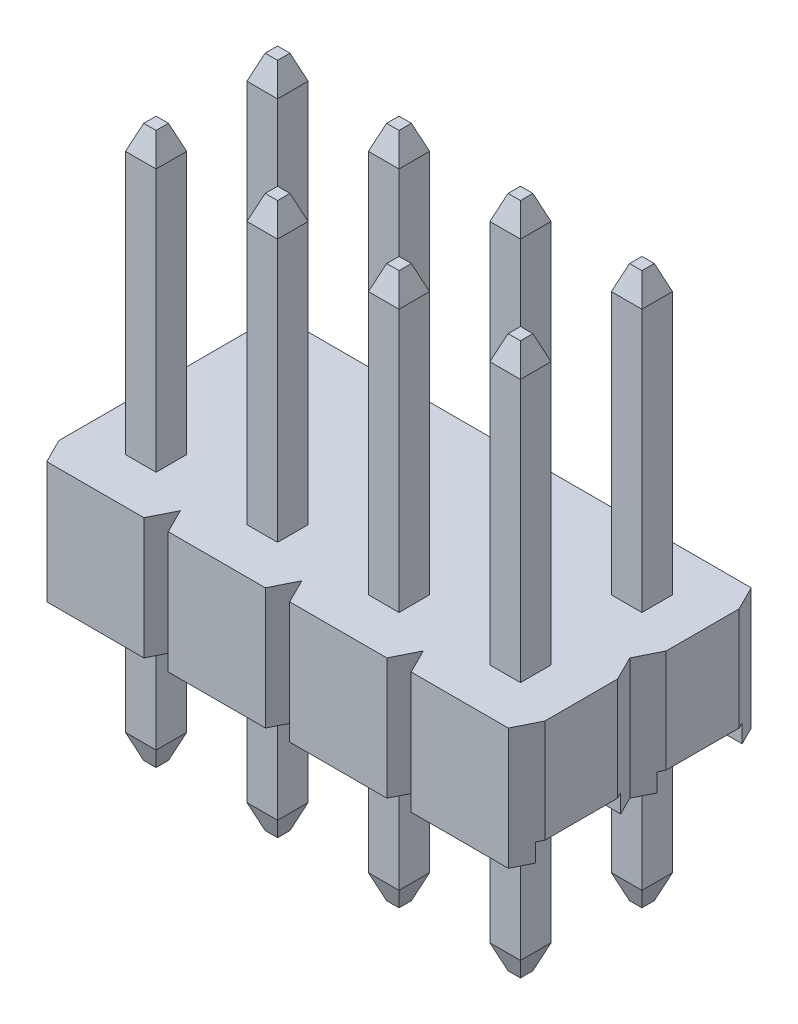
from build123d import *
from OCP.BRepFilletAPI import BRepFilletAPI_MakeChamfer

# Parameters (mm, degrees)
SKETCH1_W                     = 2.54
SKETCH1_H                     = 2.54
MAIN_BODY_DEPTH               = 2.54
SKETCH3_W                     = 1.778
SKETCH3_H                     = 0.381
CUT_EXTRUDE1_DEPTH            = 5.399409051
CUT_EXTRUDE2_DEPTH            = 5.399409051
BODY_PATTERN_COUNT            = 4
BODY_PATTERN_PITCH            = 2.54
PIN_START                     = -5.54
SKETCH2_W                     = 0.64
SKETCH2_H                     = 0.64
PIN_DEPTH                     = 11.54
CHAMFER1_SIZE                 = 0.508
CHAMFER1_SIZE2                = 0.1905
CHAMFER2_SIZE                 = 0.1905
CHAMFER2_SIZE2                = 0.508
PIN_PATTERN_COUNT             = 4
PIN_PATTERN_PITCH             = 2.54
CHAMFER1_OF_PIN_PATTERN_SIZE  = 0.508
CHAMFER1_OF_PIN_PATTERN_SIZE2 = 0.1905
CHAMFER2_OF_PIN_PATTERN_SIZE2 = 0.1905
CHAMFER2_OF_PIN_PATTERN_SIZE  = 0.508
ROW_START                     = 0.381
ROW_PATTERN_DEPTH             = 2.159
ROW_START_2                   = -2.492
ROW_PATTERN_2_OUTLINE_W       = 0.64
ROW_PATTERN_2_OUTLINE_H       = 0.64
ROW_PATTERN_2_DEPTH           = 10.524
ROW_PATTERN_3_DEPTH           = 0.381


with BuildPart() as part:
    # Sketch1 → Main Body (new body)
    with BuildSketch(Plane(origin=(0, 0, 0), x_dir=(1, 0, 0), z_dir=(0, 1, 0))):
        with Locations((1.27, 1.27)):
            Rectangle(SKETCH1_W, SKETCH1_H)
    main_body = extrude(amount=MAIN_BODY_DEPTH)

    # Sketch3 → Cut-Extrude1 (cut, through all)
    with BuildSketch(Plane.ZY):
        with Locations((-1.27, 0.1905)):
            Rectangle(SKETCH3_W, SKETCH3_H)
    cut_extrude1 = extrude(amount=-CUT_EXTRUDE1_DEPTH, mode=Mode.SUBTRACT)

    # Sketch4 → Cut-Extrude2 (cut, through all)
    with BuildSketch(Plane(origin=(0, 2.54, 0), x_dir=(1, 0, 0), z_dir=(0, 1, 0))):
        Polygon((0.254, 2.54), (0, 2.54), (0, 2.032), align=None)
        Polygon((2.54, 2.54), (2.286, 2.54), (2.54, 2.032), align=None)
        Polygon((0.254, 0), (0, 0.508), (0, 0), align=None)
        Polygon((2.54, 0), (2.286, 0), (2.54, 0.508), align=None)
    cut_extrude2 = extrude(amount=-CUT_EXTRUDE2_DEPTH, mode=Mode.SUBTRACT)

    # Body Pattern: Main Body, Cut-Extrude1, Cut-Extrude2 ×4
    with Locations(*[(-i * BODY_PATTERN_PITCH, 0, 0) for i in range(1, BODY_PATTERN_COUNT)]):
        add(main_body)
        add(cut_extrude1, mode=Mode.SUBTRACT)
        add(cut_extrude2, mode=Mode.SUBTRACT)

    # Sketch2 → Pin (add)
    with BuildSketch(Plane(origin=(0, 2.54, 0), x_dir=(1, 0, 0), z_dir=(0, 1, 0)).offset(PIN_START)):
        with Locations((1.27, 1.27)):
            Rectangle(SKETCH2_W, SKETCH2_H)
    pin = extrude(amount=PIN_DEPTH)

    # Chamfer1: one chamfer whose edges measure the first distance from different faces: ONE call of the kernel's chamfer builder (chamfer() names one face for all edges)
    chamfer1_edges_1 = [part.edges().sort_by_distance(p)[0] for p in [
        (0.95, 8.54, -1.27),
    ]]
    chamfer1_side_1 = [part.faces().sort_by_distance(p)[0] for p in [
        (0.95, 5.54, -1.27),
    ]]
    chamfer1_edges_2 = [part.edges().sort_by_distance(p)[0] for p in [
        (1.27, 8.54, -0.95),
    ]]
    chamfer1_side_2 = [part.faces().sort_by_distance(p)[0] for p in [
        (1.27, 5.54, -0.95),
    ]]
    chamfer1_edges_3 = [part.edges().sort_by_distance(p)[0] for p in [
        (1.59, 8.54, -1.27),
    ]]
    chamfer1_side_3 = [part.faces().sort_by_distance(p)[0] for p in [
        (1.59, 5.54, -1.27),
    ]]
    chamfer1_edges_4 = [part.edges().sort_by_distance(p)[0] for p in [
        (1.27, 8.54, -1.59),
    ]]
    chamfer1_side_4 = [part.faces().sort_by_distance(p)[0] for p in [
        (1.27, 5.54, -1.59),
    ]]
    chamfer1 = BRepFilletAPI_MakeChamfer(part.part.solid().wrapped)
    for e in chamfer1_edges_1:
        chamfer1.Add(CHAMFER1_SIZE, CHAMFER1_SIZE2, e.wrapped, chamfer1_side_1[0].wrapped)  # the first distance lies on this face
    for e in chamfer1_edges_2:
        chamfer1.Add(CHAMFER1_SIZE, CHAMFER1_SIZE2, e.wrapped, chamfer1_side_2[0].wrapped)  # the first distance lies on this face
    for e in chamfer1_edges_3:
        chamfer1.Add(CHAMFER1_SIZE, CHAMFER1_SIZE2, e.wrapped, chamfer1_side_3[0].wrapped)  # the first distance lies on this face
    for e in chamfer1_edges_4:
        chamfer1.Add(CHAMFER1_SIZE, CHAMFER1_SIZE2, e.wrapped, chamfer1_side_4[0].wrapped)  # the first distance lies on this face
    add(Compound.cast(chamfer1.Shape()), mode=Mode.REPLACE)

    # Chamfer2
    chamfer2_edges = [part.edges().sort_by_distance(p)[0] for p in [
        (1.27, -3, -0.95),
        (1.59, -3, -1.27),
        (1.27, -3, -1.59),
        (0.95, -3, -1.27),
    ]]
    chamfer2_side = [part.faces().sort_by_distance(p)[0] for p in [
        (1.27, -3, -1.27),
    ]]
    chamfer(chamfer2_edges, length=CHAMFER2_SIZE, length2=CHAMFER2_SIZE2, reference=chamfer2_side[0])

    # Pin Pattern: Pin ×4
    with Locations(*[(-i * PIN_PATTERN_PITCH, 0, 0) for i in range(1, PIN_PATTERN_COUNT)]):
        add(pin)

    # Chamfer1 of Pin Pattern: one chamfer whose edges measure the first distance from different faces: ONE call of the kernel's chamfer builder (chamfer() names one face for all edges)
    chamfer1_of_pin_pattern_edges_1 = [part.edges().sort_by_distance(p)[0] for p in [
        (-1.59, 8.54, -1.27),
    ]]
    chamfer1_of_pin_pattern_side_1 = [part.faces().sort_by_distance(p)[0] for p in [
        (-1.59, 5.54, -1.27),
    ]]
    chamfer1_of_pin_pattern_edges_2 = [part.edges().sort_by_distance(p)[0] for p in [
        (-1.27, 8.54, -0.95),
    ]]
    chamfer1_of_pin_pattern_side_2 = [part.faces().sort_by_distance(p)[0] for p in [
        (-1.27, 5.54, -0.95),
    ]]
    chamfer1_of_pin_pattern_edges_3 = [part.edges().sort_by_distance(p)[0] for p in [
        (-0.95, 8.54, -1.27),
    ]]
    chamfer1_of_pin_pattern_side_3 = [part.faces().sort_by_distance(p)[0] for p in [
        (-0.95, 5.54, -1.27),
    ]]
    chamfer1_of_pin_pattern_edges_4 = [part.edges().sort_by_distance(p)[0] for p in [
        (-1.27, 8.54, -1.59),
    ]]
    chamfer1_of_pin_pattern_side_4 = [part.faces().sort_by_distance(p)[0] for p in [
        (-1.27, 5.54, -1.59),
    ]]
    chamfer1_of_pin_pattern_edges_5 = [part.edges().sort_by_distance(p)[0] for p in [
        (-4.13, 8.54, -1.27),
    ]]
    chamfer1_of_pin_pattern_side_5 = [part.faces().sort_by_distance(p)[0] for p in [
        (-4.13, 5.54, -1.27),
    ]]
    chamfer1_of_pin_pattern_edges_6 = [part.edges().sort_by_distance(p)[0] for p in [
        (-3.81, 8.54, -0.95),
    ]]
    chamfer1_of_pin_pattern_side_6 = [part.faces().sort_by_distance(p)[0] for p in [
        (-3.81, 5.54, -0.95),
    ]]
    chamfer1_of_pin_pattern_edges_7 = [part.edges().sort_by_distance(p)[0] for p in [
        (-3.49, 8.54, -1.27),
    ]]
    chamfer1_of_pin_pattern_side_7 = [part.faces().sort_by_distance(p)[0] for p in [
        (-3.49, 5.54, -1.27),
    ]]
    chamfer1_of_pin_pattern_edges_8 = [part.edges().sort_by_distance(p)[0] for p in [
        (-3.81, 8.54, -1.59),
    ]]
    chamfer1_of_pin_pattern_side_8 = [part.faces().sort_by_distance(p)[0] for p in [
        (-3.81, 5.54, -1.59),
    ]]
    chamfer1_of_pin_pattern_edges_9 = [part.edges().sort_by_distance(p)[0] for p in [
        (-6.67, 8.54, -1.27),
    ]]
    chamfer1_of_pin_pattern_side_9 = [part.faces().sort_by_distance(p)[0] for p in [
        (-6.67, 5.54, -1.27),
    ]]
    chamfer1_of_pin_pattern_edges_10 = [part.edges().sort_by_distance(p)[0] for p in [
        (-6.35, 8.54, -0.95),
    ]]
    chamfer1_of_pin_pattern_side_10 = [part.faces().sort_by_distance(p)[0] for p in [
        (-6.35, 5.54, -0.95),
    ]]
    chamfer1_of_pin_pattern_edges_11 = [part.edges().sort_by_distance(p)[0] for p in [
        (-6.03, 8.54, -1.27),
    ]]
    chamfer1_of_pin_pattern_side_11 = [part.faces().sort_by_distance(p)[0] for p in [
        (-6.03, 5.54, -1.27),
    ]]
    chamfer1_of_pin_pattern_edges_12 = [part.edges().sort_by_distance(p)[0] for p in [
        (-6.35, 8.54, -1.59),
    ]]
    chamfer1_of_pin_pattern_side_12 = [part.faces().sort_by_distance(p)[0] for p in [
        (-6.35, 5.54, -1.59),
    ]]
    chamfer1_of_pin_pattern = BRepFilletAPI_MakeChamfer(part.part.solid().wrapped)
    for e in chamfer1_of_pin_pattern_edges_1:
        chamfer1_of_pin_pattern.Add(CHAMFER1_OF_PIN_PATTERN_SIZE, CHAMFER1_OF_PIN_PATTERN_SIZE2, e.wrapped, chamfer1_of_pin_pattern_side_1[0].wrapped)  # the first distance lies on this face
    for e in chamfer1_of_pin_pattern_edges_2:
        chamfer1_of_pin_pattern.Add(CHAMFER1_OF_PIN_PATTERN_SIZE, CHAMFER1_OF_PIN_PATTERN_SIZE2, e.wrapped, chamfer1_of_pin_pattern_side_2[0].wrapped)  # the first distance lies on this face
    for e in chamfer1_of_pin_pattern_edges_3:
        chamfer1_of_pin_pattern.Add(CHAMFER1_OF_PIN_PATTERN_SIZE, CHAMFER1_OF_PIN_PATTERN_SIZE2, e.wrapped, chamfer1_of_pin_pattern_side_3[0].wrapped)  # the first distance lies on this face
    for e in chamfer1_of_pin_pattern_edges_4:
        chamfer1_of_pin_pattern.Add(CHAMFER1_OF_PIN_PATTERN_SIZE, CHAMFER1_OF_PIN_PATTERN_SIZE2, e.wrapped, chamfer1_of_pin_pattern_side_4[0].wrapped)  # the first distance lies on this face
    for e in chamfer1_of_pin_pattern_edges_5:
        chamfer1_of_pin_pattern.Add(CHAMFER1_OF_PIN_PATTERN_SIZE, CHAMFER1_OF_PIN_PATTERN_SIZE2, e.wrapped, chamfer1_of_pin_pattern_side_5[0].wrapped)  # the first distance lies on this face
    for e in chamfer1_of_pin_pattern_edges_6:
        chamfer1_of_pin_pattern.Add(CHAMFER1_OF_PIN_PATTERN_SIZE, CHAMFER1_OF_PIN_PATTERN_SIZE2, e.wrapped, chamfer1_of_pin_pattern_side_6[0].wrapped)  # the first distance lies on this face
    for e in chamfer1_of_pin_pattern_edges_7:
        chamfer1_of_pin_pattern.Add(CHAMFER1_OF_PIN_PATTERN_SIZE, CHAMFER1_OF_PIN_PATTERN_SIZE2, e.wrapped, chamfer1_of_pin_pattern_side_7[0].wrapped)  # the first distance lies on this face
    for e in chamfer1_of_pin_pattern_edges_8:
        chamfer1_of_pin_pattern.Add(CHAMFER1_OF_PIN_PATTERN_SIZE, CHAMFER1_OF_PIN_PATTERN_SIZE2, e.wrapped, chamfer1_of_pin_pattern_side_8[0].wrapped)  # the first distance lies on this face
    for e in chamfer1_of_pin_pattern_edges_9:
        chamfer1_of_pin_pattern.Add(CHAMFER1_OF_PIN_PATTERN_SIZE, CHAMFER1_OF_PIN_PATTERN_SIZE2, e.wrapped, chamfer1_of_pin_pattern_side_9[0].wrapped)  # the first distance lies on this face
    for e in chamfer1_of_pin_pattern_edges_10:
        chamfer1_of_pin_pattern.Add(CHAMFER1_OF_PIN_PATTERN_SIZE, CHAMFER1_OF_PIN_PATTERN_SIZE2, e.wrapped, chamfer1_of_pin_pattern_side_10[0].wrapped)  # the first distance lies on this face
    for e in chamfer1_of_pin_pattern_edges_11:
        chamfer1_of_pin_pattern.Add(CHAMFER1_OF_PIN_PATTERN_SIZE, CHAMFER1_OF_PIN_PATTERN_SIZE2, e.wrapped, chamfer1_of_pin_pattern_side_11[0].wrapped)  # the first distance lies on this face
    for e in chamfer1_of_pin_pattern_edges_12:
        chamfer1_of_pin_pattern.Add(CHAMFER1_OF_PIN_PATTERN_SIZE, CHAMFER1_OF_PIN_PATTERN_SIZE2, e.wrapped, chamfer1_of_pin_pattern_side_12[0].wrapped)  # the first distance lies on this face
    add(Compound.cast(chamfer1_of_pin_pattern.Shape()), mode=Mode.REPLACE)

    # Chamfer2 of Pin Pattern
    chamfer2_of_pin_pattern_edges = [part.edges().sort_by_distance(p)[0] for p in [
        (-1.27, -3, -0.95),
        (-0.95, -3, -1.27),
        (-1.27, -3, -1.59),
        (-1.59, -3, -1.27),
        (-3.81, -3, -0.95),
        (-3.49, -3, -1.27),
        (-3.81, -3, -1.59),
        (-4.13, -3, -1.27),
        (-6.35, -3, -0.95),
        (-6.03, -3, -1.27),
        (-6.35, -3, -1.59),
        (-6.67, -3, -1.27),
    ]]
    chamfer(chamfer2_of_pin_pattern_edges, length=CHAMFER2_OF_PIN_PATTERN_SIZE, length2=CHAMFER2_OF_PIN_PATTERN_SIZE2)

    # Row Pattern: read off the stored shape, not the designer's step
    # Row Pattern outline → Row Pattern (add)
    with BuildSketch(Plane(origin=(0, 0, 0), x_dir=(1, 0, 0), z_dir=(0, 1, 0)).offset(ROW_START)):
        Polygon((-7.62, 3.048), (-7.366, 2.54), (-5.334, 2.54), (-5.08, 3.048), (-4.826, 2.54), (-2.794, 2.54), (-2.54, 3.048), (-2.286, 2.54), (-0.254, 2.54), (0, 3.048), (0.254, 2.54), (2.286, 2.54), (2.54, 3.048), (2.54, 4.572), (2.286, 5.08), (0.254, 5.08), (0, 4.572), (-0.254, 5.08), (-2.286, 5.08), (-2.54, 4.572), (-2.794, 5.08), (-4.826, 5.08), (-5.08, 4.572), (-5.334, 5.08), (-7.366, 5.08), (-7.62, 4.572), align=None)
    extrude(amount=ROW_PATTERN_DEPTH)

    # Row Pattern 2 outline → Row Pattern 2 (add)
    with BuildSketch(Plane(origin=(0, 0, 0), x_dir=(1, 0, 0), z_dir=(0, 1, 0)).offset(ROW_START_2)):
        with Locations((1.27, 3.81)):
            Rectangle(ROW_PATTERN_2_OUTLINE_W, ROW_PATTERN_2_OUTLINE_H)
        with Locations((-1.27, 3.81)):
            Rectangle(ROW_PATTERN_2_OUTLINE_W, ROW_PATTERN_2_OUTLINE_H)
        with Locations((-3.81, 3.81)):
            Rectangle(ROW_PATTERN_2_OUTLINE_W, ROW_PATTERN_2_OUTLINE_H)
        with Locations((-6.35, 3.81)):
            Rectangle(ROW_PATTERN_2_OUTLINE_W, ROW_PATTERN_2_OUTLINE_H)
    extrude(amount=ROW_PATTERN_2_DEPTH)

    # Row Pattern 3 outline → Row Pattern 3 (add)
    with BuildSketch(Plane(origin=(0, 0, 0), x_dir=(1, 0, 0), z_dir=(0, 1, 0))):
        Polygon((-5.1435, 2.921), (-7.5565, 2.921), (-7.366, 2.54), (-5.334, 2.54), align=None)
        Polygon((-2.6035, 2.921), (-5.0165, 2.921), (-4.826, 2.54), (-2.794, 2.54), align=None)
        Polygon((-7.366, 5.08), (-7.5565, 4.699), (-5.1435, 4.699), (-5.334, 5.08), align=None)
        Polygon((-0.0635, 2.921), (-2.4765, 2.921), (-2.286, 2.54), (-0.254, 2.54), align=None)
        Polygon((-4.826, 5.08), (-5.0165, 4.699), (-2.6035, 4.699), (-2.794, 5.08), align=None)
        Polygon((2.4765, 2.921), (0.0635, 2.921), (0.254, 2.54), (2.286, 2.54), align=None)
        Polygon((-2.286, 5.08), (-2.4765, 4.699), (-0.0635, 4.699), (-0.254, 5.08), align=None)
        Polygon((0.254, 5.08), (0.0635, 4.699), (2.4765, 4.699), (2.286, 5.08), align=None)
    extrude(amount=ROW_PATTERN_3_DEPTH)

    # Row Pattern 4: loft between two sections, ruled curve by curve
    row_pattern_4_from = [
        Edge.make_line((1.59, -2.492, -3.49), (1.59, -2.492, -4.13)),
        Edge.make_line((0.95, -2.492, -3.49), (0.95, -2.492, -4.13)),
        Edge.make_line((0.95, -2.492, -3.49), (1.59, -2.492, -3.49)),
        Edge.make_line((1.59, -2.492, -4.13), (0.95, -2.492, -4.13)),
    ]
    row_pattern_4_to = [
        Edge.make_line((1.3995, -3, -3.6805), (1.3995, -3, -3.9395)),
        Edge.make_line((1.1405, -3, -3.6805), (1.1405, -3, -3.9395)),
        Edge.make_line((1.1405, -3, -3.6805), (1.3995, -3, -3.6805)),
        Edge.make_line((1.3995, -3, -3.9395), (1.1405, -3, -3.9395)),
    ]
    row_pattern_4 = Solid(Shell([*[Face.make_surface_from_curves(row_pattern_4_from[k], row_pattern_4_to[k]) for k in range(4)], Face(Wire(row_pattern_4_from)), Face(Wire(row_pattern_4_to))]))
    add(row_pattern_4)

    # Row Pattern 5: loft between two sections, ruled curve by curve
    row_pattern_5_from = [
        Edge.make_line((-0.95, -2.492, -3.49), (-0.95, -2.492, -4.13)),
        Edge.make_line((-1.59, -2.492, -3.49), (-1.59, -2.492, -4.13)),
        Edge.make_line((-1.59, -2.492, -3.49), (-0.95, -2.492, -3.49)),
        Edge.make_line((-0.95, -2.492, -4.13), (-1.59, -2.492, -4.13)),
    ]
    row_pattern_5_to = [
        Edge.make_line((-1.1405, -3, -3.6805), (-1.1405, -3, -3.9395)),
        Edge.make_line((-1.3995, -3, -3.6805), (-1.3995, -3, -3.9395)),
        Edge.make_line((-1.3995, -3, -3.6805), (-1.1405, -3, -3.6805)),
        Edge.make_line((-1.1405, -3, -3.9395), (-1.3995, -3, -3.9395)),
    ]
    row_pattern_5 = Solid(Shell([*[Face.make_surface_from_curves(row_pattern_5_from[k], row_pattern_5_to[k]) for k in range(4)], Face(Wire(row_pattern_5_from)), Face(Wire(row_pattern_5_to))]))
    add(row_pattern_5)

    # Row Pattern 6: loft between two sections, ruled curve by curve
    row_pattern_6_from = [
        Edge.make_line((-3.49, -2.492, -3.49), (-3.49, -2.492, -4.13)),
        Edge.make_line((-4.13, -2.492, -3.49), (-4.13, -2.492, -4.13)),
        Edge.make_line((-4.13, -2.492, -3.49), (-3.49, -2.492, -3.49)),
        Edge.make_line((-3.49, -2.492, -4.13), (-4.13, -2.492, -4.13)),
    ]
    row_pattern_6_to = [
        Edge.make_line((-3.6805, -3, -3.6805), (-3.6805, -3, -3.9395)),
        Edge.make_line((-3.9395, -3, -3.6805), (-3.9395, -3, -3.9395)),
        Edge.make_line((-3.9395, -3, -3.6805), (-3.6805, -3, -3.6805)),
        Edge.make_line((-3.6805, -3, -3.9395), (-3.9395, -3, -3.9395)),
    ]
    row_pattern_6 = Solid(Shell([*[Face.make_surface_from_curves(row_pattern_6_from[k], row_pattern_6_to[k]) for k in range(4)], Face(Wire(row_pattern_6_from)), Face(Wire(row_pattern_6_to))]))
    add(row_pattern_6)

    # Row Pattern 7: loft between two sections, ruled curve by curve
    row_pattern_7_from = [
        Edge.make_line((-6.03, -2.492, -3.49), (-6.03, -2.492, -4.13)),
        Edge.make_line((-6.67, -2.492, -3.49), (-6.67, -2.492, -4.13)),
        Edge.make_line((-6.67, -2.492, -3.49), (-6.03, -2.492, -3.49)),
        Edge.make_line((-6.03, -2.492, -4.13), (-6.67, -2.492, -4.13)),
    ]
    row_pattern_7_to = [
        Edge.make_line((-6.2205, -3, -3.6805), (-6.2205, -3, -3.9395)),
        Edge.make_line((-6.4795, -3, -3.6805), (-6.4795, -3, -3.9395)),
        Edge.make_line((-6.4795, -3, -3.6805), (-6.2205, -3, -3.6805)),
        Edge.make_line((-6.2205, -3, -3.9395), (-6.4795, -3, -3.9395)),
    ]
    row_pattern_7 = Solid(Shell([*[Face.make_surface_from_curves(row_pattern_7_from[k], row_pattern_7_to[k]) for k in range(4)], Face(Wire(row_pattern_7_from)), Face(Wire(row_pattern_7_to))]))
    add(row_pattern_7)

    # Row Pattern 8: loft between two sections, ruled curve by curve
    row_pattern_8_from = [
        Edge.make_line((1.3995, 8.54, -3.6805), (1.3995, 8.54, -3.9395)),
        Edge.make_line((1.1405, 8.54, -3.9395), (1.1405, 8.54, -3.6805)),
        Edge.make_line((1.3995, 8.54, -3.9395), (1.1405, 8.54, -3.9395)),
        Edge.make_line((1.3995, 8.54, -3.6805), (1.1405, 8.54, -3.6805)),
    ]
    row_pattern_8_to = [
        Edge.make_line((1.59, 8.032, -3.49), (1.59, 8.032, -4.13)),
        Edge.make_line((0.95, 8.032, -4.13), (0.95, 8.032, -3.49)),
        Edge.make_line((1.59, 8.032, -4.13), (0.95, 8.032, -4.13)),
        Edge.make_line((1.59, 8.032, -3.49), (0.95, 8.032, -3.49)),
    ]
    row_pattern_8 = Solid(Shell([*[Face.make_surface_from_curves(row_pattern_8_from[k], row_pattern_8_to[k]) for k in range(4)], Face(Wire(row_pattern_8_from)), Face(Wire(row_pattern_8_to))]))
    add(row_pattern_8)

    # Row Pattern 9: loft between two sections, ruled curve by curve
    row_pattern_9_from = [
        Edge.make_line((-1.1405, 8.54, -3.6805), (-1.1405, 8.54, -3.9395)),
        Edge.make_line((-1.3995, 8.54, -3.9395), (-1.3995, 8.54, -3.6805)),
        Edge.make_line((-1.1405, 8.54, -3.9395), (-1.3995, 8.54, -3.9395)),
        Edge.make_line((-1.1405, 8.54, -3.6805), (-1.3995, 8.54, -3.6805)),
    ]
    row_pattern_9_to = [
        Edge.make_line((-0.95, 8.032, -3.49), (-0.95, 8.032, -4.13)),
        Edge.make_line((-1.59, 8.032, -4.13), (-1.59, 8.032, -3.49)),
        Edge.make_line((-0.95, 8.032, -4.13), (-1.59, 8.032, -4.13)),
        Edge.make_line((-0.95, 8.032, -3.49), (-1.59, 8.032, -3.49)),
    ]
    row_pattern_9 = Solid(Shell([*[Face.make_surface_from_curves(row_pattern_9_from[k], row_pattern_9_to[k]) for k in range(4)], Face(Wire(row_pattern_9_from)), Face(Wire(row_pattern_9_to))]))
    add(row_pattern_9)

    # Row Pattern 10: loft between two sections, ruled curve by curve
    row_pattern_10_from = [
        Edge.make_line((-3.6805, 8.54, -3.6805), (-3.6805, 8.54, -3.9395)),
        Edge.make_line((-3.9395, 8.54, -3.9395), (-3.9395, 8.54, -3.6805)),
        Edge.make_line((-3.6805, 8.54, -3.9395), (-3.9395, 8.54, -3.9395)),
        Edge.make_line((-3.6805, 8.54, -3.6805), (-3.9395, 8.54, -3.6805)),
    ]
    row_pattern_10_to = [
        Edge.make_line((-3.49, 8.032, -3.49), (-3.49, 8.032, -4.13)),
        Edge.make_line((-4.13, 8.032, -4.13), (-4.13, 8.032, -3.49)),
        Edge.make_line((-3.49, 8.032, -4.13), (-4.13, 8.032, -4.13)),
        Edge.make_line((-3.49, 8.032, -3.49), (-4.13, 8.032, -3.49)),
    ]
    row_pattern_10 = Solid(Shell([*[Face.make_surface_from_curves(row_pattern_10_from[k], row_pattern_10_to[k]) for k in range(4)], Face(Wire(row_pattern_10_from)), Face(Wire(row_pattern_10_to))]))
    add(row_pattern_10)

    # Row Pattern 11: loft between two sections, ruled curve by curve
    row_pattern_11_from = [
        Edge.make_line((-6.2205, 8.54, -3.6805), (-6.2205, 8.54, -3.9395)),
        Edge.make_line((-6.4795, 8.54, -3.9395), (-6.4795, 8.54, -3.6805)),
        Edge.make_line((-6.2205, 8.54, -3.9395), (-6.4795, 8.54, -3.9395)),
        Edge.make_line((-6.2205, 8.54, -3.6805), (-6.4795, 8.54, -3.6805)),
    ]
    row_pattern_11_to = [
        Edge.make_line((-6.03, 8.032, -3.49), (-6.03, 8.032, -4.13)),
        Edge.make_line((-6.67, 8.032, -4.13), (-6.67, 8.032, -3.49)),
        Edge.make_line((-6.03, 8.032, -4.13), (-6.67, 8.032, -4.13)),
        Edge.make_line((-6.03, 8.032, -3.49), (-6.67, 8.032, -3.49)),
    ]
    row_pattern_11 = Solid(Shell([*[Face.make_surface_from_curves(row_pattern_11_from[k], row_pattern_11_to[k]) for k in range(4)], Face(Wire(row_pattern_11_from)), Face(Wire(row_pattern_11_to))]))
    add(row_pattern_11)


solid = part.part
